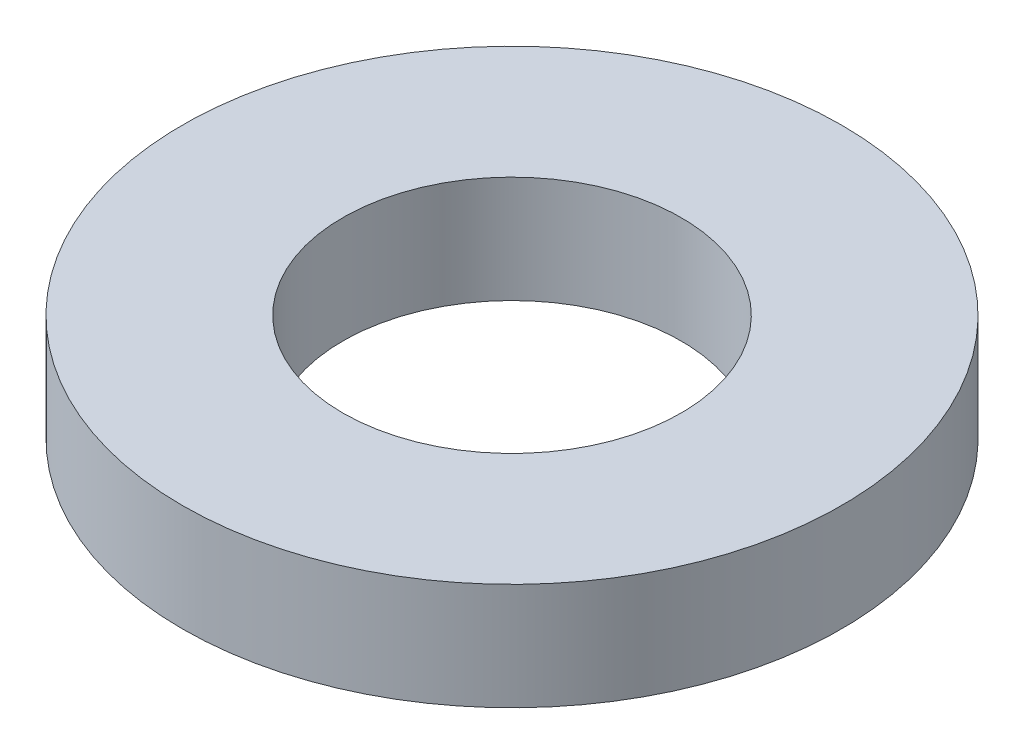
from build123d import *

# Parameters (mm, degrees)
SKETCH1_R           = 92.5
BOSS_EXTRUDE1_DEPTH = 30
SKETCH2_R           = 47.5
CUT_EXTRUDE1_DEPTH  = 135.210655315


with BuildPart() as part:
    # Sketch1 → Boss-Extrude1 (new body)
    with BuildSketch(Plane(origin=(0, 0, 0), x_dir=(1, 0, 0), z_dir=(0, 1, 0))):
        Circle(SKETCH1_R)
    extrude(amount=BOSS_EXTRUDE1_DEPTH)

    # Sketch2 → Cut-Extrude1 (cut, through all)
    with BuildSketch(Plane(origin=(0, 0, 0), x_dir=(1, 0, 0), z_dir=(0, 1, 0))):
        Circle(SKETCH2_R)
    extrude(amount=CUT_EXTRUDE1_DEPTH, mode=Mode.SUBTRACT)


solid = part.part
